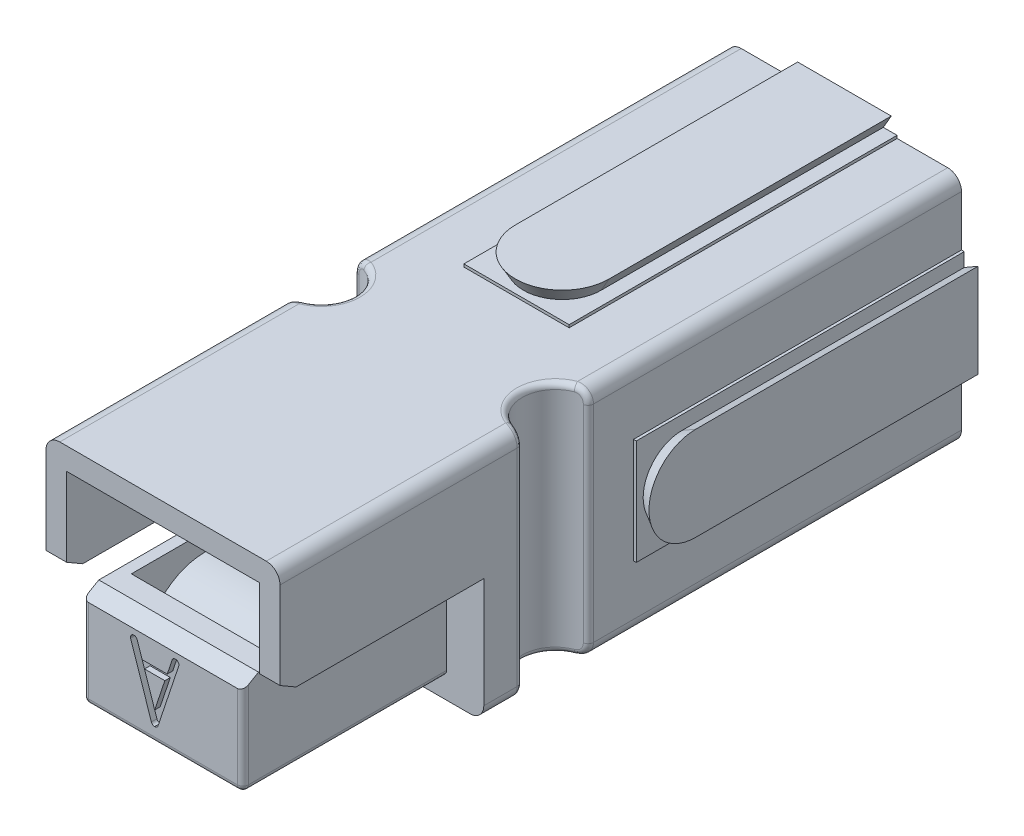
from build123d import *

# Parameters (mm, degrees)
EXTRUSION1_OUTLINE_W     = 8.5
EXTRUSION1_OUTLINE_H     = 8.5
EXTRUSION1_DEPTH         = 24.75
ENL_V_MAT_EXTRU_5_DEPTH  = 7.4
SKETCH2_W                = 7
SKETCH2_H                = 3.4
CUT_EXTRUDE12_DEPTH      = 8
ESQUISSE8_W              = 5.7
ESQUISSE8_H              = 5.7
ENL_V_MAT_EXTRU_7_DEPTH  = 10
CUT_EXTRUDE7_DEPTH       = 10.25
CUT_REVOLVE1_ANGLE       = 180
BOSS_EXTRUDE5_DEPTH      = 0.1
CUT_REVOLVE2_ANGLE       = 180
BOSS_EXTRUDE6_DEPTH      = 0.1
SKETCH16_W               = 3.82264973
SKETCH16_H               = 11.911324865
BOSS_EXTRUDE7_DEPTH      = 0.1
SKETCH17_W               = 11.911324865
SKETCH17_H               = 3.82264973
BOSS_EXTRUDE8_DEPTH      = 0.1
BOSS_EXTRUDE4_DEPTH      = 10.25
REVOLVE1_ANGLE           = 180
REVOLVE2_ANGLE           = 180
SKETCH13_W               = 5
SKETCH13_H               = 6.65
CUT_EXTRUDE16_DEPTH      = 2.5
EXTRUSION2_DEPTH         = 1.75
EXTRUSION2_DEPTH_BACK    = 1.75
SKETCH9_R                = 2
CUT_EXTRUDE9_DEPTH       = 6.75
CUT_EXTRUDE10_DEPTH      = 8.6
FILLET1_R                = 0.5
FILLET2_R                = 0.2
CUT_EXTRUDE11_DEPTH      = 4.5
CUT_EXTRUDE11_DEPTH_BACK = 4.5
CUT_EXTRUDE17_DEPTH      = 0.2
SCALE1_SCALE             = 0.956


# Read off the part's stored shape, not the designer's step: Extrusion1
with BuildPart() as part:
    # Extrusion1 outline → Extrusion1 (new body)
    with BuildSketch(Plane.XY):
        Rectangle(EXTRUSION1_OUTLINE_W, EXTRUSION1_OUTLINE_H)
    extrude(amount=EXTRUSION1_DEPTH)

    # Esquisse5 → Enlèv. mat.-Extru.5 (cut)
    with BuildSketch(Plane.XY.offset(24.75)):
        Polygon((-4.25, 0.25), (-4.25, -4.25), (4.25, -4.25), (4.25, 0.25), (2.9, 0.25), (2.9, -3.51), (0, -3.51), (-2.9, -3.51), (-2.9, 0.25), align=None)
    extrude(amount=-ENL_V_MAT_EXTRU_5_DEPTH, mode=Mode.SUBTRACT)

    # Sketch2 → Cut-Extrude12 (cut)
    with BuildSketch(Plane.XY.offset(17.35)):
        with Locations((0, 1.75)):
            Rectangle(SKETCH2_W, SKETCH2_H)
    extrude(amount=CUT_EXTRUDE12_DEPTH, mode=Mode.SUBTRACT)

    # Esquisse8 → Enlèv. mat.-Extru.7 (cut)
    with BuildSketch(Plane(origin=(0, 0, 0), x_dir=(-1, 0, 0), z_dir=(0, 0, -1))):
        Rectangle(ESQUISSE8_W, ESQUISSE8_H)
    extrude(amount=-ENL_V_MAT_EXTRU_7_DEPTH, mode=Mode.SUBTRACT)

    # Esquisse12 → Cut-Extrude7 (cut)
    with BuildSketch(Plane(origin=(0, 0, 0), x_dir=(-1, 0, 0), z_dir=(0, 0, -1))):
        Polygon((3.75, 1.7), (4.25, 1.411324865), (4.25, -1.411324865), (3.75, -1.7), align=None)
        Polygon((-1.411324865, -4.25), (1.411324865, -4.25), (1.7, -3.75), (-1.7, -3.75), align=None)
    extrude(amount=-CUT_EXTRUDE7_DEPTH, mode=Mode.SUBTRACT)

    # Sketch3 → Cut-Revolve1 (revolve, cut)
    with BuildSketch(Plane(origin=(0, 0, 10.25), x_dir=(-1, 0, 0), z_dir=(0, 0, -1))):
        Polygon((3.75, 0), (3.75, -1.7), (4.25, -1.411324865), (4.25, 0), align=None)
    revolve(axis=Axis((-3.75, 0, 10.25), (-1, 0, 0)), revolution_arc=CUT_REVOLVE1_ANGLE, mode=Mode.SUBTRACT)

    # Sketch14 → Boss-Extrude5 (add)
    with BuildSketch(Plane.ZY.offset(4.25)):
        with BuildLine():
            Line((0, 1.411324865), (10.25, 1.411324865))
            ThreePointArc((10.25, 1.411324865), (11.661324865, 0), (10.25, -1.411324865))
            Line((10.25, -1.411324865), (0, -1.411324865))
            Line((0, -1.411324865), (0, -1.911324865))
            Line((0, -1.911324865), (11.911324865, -1.911324865))
            Line((11.911324865, -1.911324865), (11.911324865, 1.911324865))
            Line((11.911324865, 1.911324865), (0, 1.911324865))
            Line((0, 1.911324865), (0, 1.411324865))
        make_face()
    extrude(amount=BOSS_EXTRUDE5_DEPTH)

    # Sketch4 → Cut-Revolve2 (revolve, cut)
    with BuildSketch(Plane(origin=(0, 0, 10.25), x_dir=(-1, 0, 0), z_dir=(0, 0, -1))):
        Polygon((0, -3.75), (1.7, -3.75), (1.411324865, -4.25), (0, -4.25), align=None)
    revolve(axis=Axis((0, -3.75, 10.25), (0, 1, 0)), revolution_arc=CUT_REVOLVE2_ANGLE, mode=Mode.SUBTRACT)

    # Sketch15 → Boss-Extrude6 (add)
    with BuildSketch(Plane.XZ.offset(4.25)):
        with BuildLine():
            Line((-1.411324865, 0), (-1.411324865, 10.25))
            ThreePointArc((-1.411324865, 10.25), (0, 11.661324865), (1.411324865, 10.25))
            Line((1.411324865, 10.25), (1.411324865, 0))
            Line((1.411324865, 0), (1.911324865, 0))
            Line((1.911324865, 0), (1.911324865, 11.911324865))
            Line((1.911324865, 11.911324865), (-1.911324865, 11.911324865))
            Line((-1.911324865, 11.911324865), (-1.911324865, 0))
            Line((-1.911324865, 0), (-1.411324865, 0))
        make_face()
    extrude(amount=BOSS_EXTRUDE6_DEPTH)

    # Sketch16 → Boss-Extrude7 (add)
    with BuildSketch(Plane(origin=(0, 4.25, 0), x_dir=(-1, 0, 0), z_dir=(0, 1, 0))):
        with Locations((0, 5.955662433)):
            Rectangle(SKETCH16_W, SKETCH16_H)
    extrude(amount=BOSS_EXTRUDE7_DEPTH)

    # Sketch17 → Boss-Extrude8 (add)
    with BuildSketch(Plane(origin=(4.25, 0, 0), x_dir=(0, 0, -1), z_dir=(1, 0, 0))):
        with Locations((-5.955662433, 0)):
            Rectangle(SKETCH17_W, SKETCH17_H)
    extrude(amount=BOSS_EXTRUDE8_DEPTH)

    # Sketch5 → Boss-Extrude4 (add)
    with BuildSketch(Plane(origin=(0, 0, 0), x_dir=(-1, 0, 0), z_dir=(0, 0, -1))):
        Polygon((1.411324865, 4.35), (-1.411324865, 4.35), (-1.7, 4.85), (1.7, 4.85), align=None)
        Polygon((-4.85, -1.7), (-4.85, 1.7), (-4.35, 1.411324865), (-4.35, -1.411324865), align=None)
    extrude(amount=-BOSS_EXTRUDE4_DEPTH)

    # Sketch6 → Revolve1 (revolve)
    with BuildSketch(Plane.XY.offset(10.25)):
        Polygon((0, 4.35), (1.411324865, 4.35), (1.7, 4.85), (0, 4.85), align=None)
    revolve(axis=Axis((0, 4.85, 10.25), (0, -1, 0)), revolution_arc=REVOLVE1_ANGLE)

    # Sketch7 → Revolve2 (revolve)
    with BuildSketch(Plane.XY.offset(10.25)):
        Polygon((4.85, -1.7), (4.85, 0), (4.35, 0), (4.35, -1.411324865), align=None)
    revolve(axis=Axis((4.85, 0, 10.25), (-1, 0, 0)), revolution_arc=REVOLVE2_ANGLE)

    # Sketch13 → Cut-Extrude16 (cut)
    with BuildSketch(Plane(origin=(0, 0.05, 0), x_dir=(-1, 0, 0), z_dir=(0, 1, 0))):
        with Locations((0, 20.075)):
            Rectangle(SKETCH13_W, SKETCH13_H)
    extrude(amount=-CUT_EXTRUDE16_DEPTH, mode=Mode.SUBTRACT)

    # Esquisse13 → Extrusion2 (add, two sides: drawn at the far end of the back side and taken through both)
    with BuildSketch(Plane(origin=(0, 0, 0), x_dir=(0, 0, -1), z_dir=(1, 0, 0)).offset(-EXTRUSION2_DEPTH_BACK)):
        with BuildLine():
            Line((-20.021850609, -0.403595516), (-16.75, -1.320909339))
            Line((-16.75, -1.320909339), (-16.75, -1.632477036))
            Line((-16.75, -1.632477036), (-20.171808548, -0.67312019))
            ThreePointArc((-20.171808548, -0.67312019), (-21.988556787, -0.221962307), (-23.305541831, -1.552250996))
            Line((-23.305541831, -1.552250996), (-23.595190502, -1.474125154))
            ThreePointArc((-23.595190502, -1.474125154), (-22.106613177, 0.05614832), (-20.021850609, -0.403595516))
        make_face()
    extrude(amount=EXTRUSION2_DEPTH + EXTRUSION2_DEPTH_BACK)

    # Sketch9 → Cut-Extrude9 (cut)
    with BuildSketch(Plane(origin=(0, 0, 10), x_dir=(-1, 0, 0), z_dir=(0, 0, -1))):
        Circle(SKETCH9_R)
    extrude(amount=-CUT_EXTRUDE9_DEPTH, mode=Mode.SUBTRACT)

    # Sketch10 → Cut-Extrude10 (cut)
    with BuildSketch(Plane(origin=(0, 4.25, 0), x_dir=(-1, 0, 0), z_dir=(0, 1, 0))):
        with BuildLine():
            Line((4.25, 13.55), (4.25, 15.95))
            ThreePointArc((4.25, 15.95), (3.05, 14.75), (4.25, 13.55))
        make_face()
        with BuildLine():
            Line((-4.25, 13.55), (-4.25, 15.95))
            ThreePointArc((-4.25, 15.95), (-3.05, 14.75), (-4.25, 13.55))
        make_face()
    extrude(amount=-CUT_EXTRUDE10_DEPTH, mode=Mode.SUBTRACT)

    # Fillet1
    fillet1_edges = [part.edges().sort_by_distance(p)[0] for p in [
        (-4.25, -4.25, 16.65),
        (-4.25, -4.25, 6.775),
        (4.25, -4.25, 16.65),
        (4.25, -4.25, 6.775),
        (-4.25, 4.25, 20.35),
        (-4.25, 4.25, 6.775),
        (4.25, 4.25, 20.35),
        (4.25, 4.25, 6.775),
    ]]
    fillet(fillet1_edges, radius=FILLET1_R)

    # Fillet2
    fillet2_edges = [part.edges().sort_by_distance(p)[0] for p in [
        (-2.9, -3.51, 21.05),
        (2.9, -3.51, 21.05),
        (-2.9, -1.73, 24.75),
        (0, -3.51, 24.75),
        (-3.05, -4.25, 14.75),
        (3.05, -4.25, 14.75),
        (-4.25, 0, 15.95),
        (-3.05, 4.25, 14.75),
        (-4.25, 0, 13.55),
        (-4.098419967, 4.108613337, 13.559612042),
        (-4.098419967, 4.108613337, 15.940387958),
        (-4.098419967, -4.108613337, 13.559612042),
        (-4.098419967, -4.108613337, 15.940387958),
        (4.25, 0, 15.95),
        (4.25, 0, 13.55),
        (3.05, 4.25, 14.75),
        (4.098419968, 4.108613336, 15.940387958),
        (4.098419968, 4.108613336, 13.559612042),
        (4.098419968, -4.108613336, 13.559612042),
        (4.098419968, -4.108613336, 15.940387958),
        (2.9, -1.73, 24.75),
    ]]
    fillet(fillet2_edges, radius=FILLET2_R)

    # Sketch11 → Cut-Extrude11 (cut, two sides: drawn at the far end of the back side and taken through both)
    with BuildSketch(Plane(origin=(0, 0, 0), x_dir=(0, 0, -1), z_dir=(1, 0, 0)).offset(-CUT_EXTRUDE11_DEPTH_BACK)):
        Polygon((-24.75, 0.587787058), (-24.75, 0.154774356), (-24.75, -0.278238346), (-24, 0.154774356), align=None)
    extrude(amount=CUT_EXTRUDE11_DEPTH + CUT_EXTRUDE11_DEPTH_BACK, mode=Mode.SUBTRACT)

    # Sketch18 → Cut-Extrude17 (cut)
    with BuildSketch(Plane.XY.offset(24.75)):
        with BuildLine():
            add(Edge.make_bspline(
                [(-0.938724046, -0.563528277), (-0.944191724, -0.551624048), (-0.954636495, -0.528883696), (-0.981106752, -0.50166242), (-1.015652341, -0.484972709), (-1.041290488, -0.481884271), (-1.054683895, -0.480270866)],
                knots=[0, 0, 0, 0, 1.030204786, 1.967974398, 2.938466691, 4, 4, 4, 4], degree=3))
            add(Edge.make_bspline(
                [(-1.054683895, -0.480270866), (-1.063349062, -0.481046677), (-1.080242864, -0.482559217), (-1.104762507, -0.48884847), (-1.126158906, -0.501075545), (-1.145241402, -0.516348404), (-1.160928732, -0.534941244), (-1.172331782, -0.556433158), (-1.179752737, -0.580064512), (-1.18071603, -0.596746257), (-1.181208286, -0.605270866)],
                knots=[0, 0, 0, 0, 1.056706776, 2.060178993, 3.045553801, 4.025758264, 5.019051294, 5.976528354, 6.965977191, 8, 8, 8, 8], degree=3))
            add(Edge.make_bspline(
                [(-1.181208286, -0.605270866), (-1.180772862, -0.611545292), (-1.179959166, -0.62327059), (-1.178383754, -0.634917439), (-1.177651375, -0.640331842)],
                knots=[0, 0, 0, 0, 1.070237272, 2, 2, 2, 2], degree=3))
            Line((-1.177651375, -0.640331842), (-0.422423193, -2.892666064))
            add(Edge.make_bspline(
                [(-0.422423193, -2.892666064), (-0.416980421, -2.905407343), (-0.406559594, -2.929802019), (-0.378619073, -2.958036272), (-0.34318481, -2.975784086), (-0.316920666, -2.978728259), (-0.303159505, -2.980270866)],
                knots=[0, 0, 0, 0, 1.046023809, 2.002735461, 2.953528535, 4, 4, 4, 4], degree=3))
            add(Edge.make_bspline(
                [(-0.303159505, -2.980270866), (-0.288705278, -2.978395566), (-0.26139994, -2.974852956), (-0.225084646, -2.956637759), (-0.196382931, -2.92915125), (-0.185703322, -2.905221586), (-0.180192025, -2.892872492)],
                knots=[0, 0, 0, 0, 1.085971307, 2.051497763, 2.994459901, 4, 4, 4, 4], degree=3))
            Line((-0.180192025, -2.892872492), (0.571543755, -0.639848026))
            add(Edge.make_bspline(
                [(0.571543755, -0.639848026), (0.573407526, -0.634638878), (0.577405925, -0.62346355), (0.578084118, -0.611602912), (0.578446186, -0.605270866)],
                knots=[0, 0, 0, 0, 0.932258736, 2, 2, 2, 2], degree=3))
            add(Edge.make_bspline(
                [(0.578446186, -0.605270866), (0.577739781, -0.596751113), (0.57635889, -0.58009657), (0.569094196, -0.556429724), (0.557649662, -0.534941594), (0.541972963, -0.51635063), (0.522890322, -0.501066439), (0.501626662, -0.488964504), (0.47733347, -0.482487569), (0.460592154, -0.481027196), (0.451921796, -0.480270866)],
                knots=[0, 0, 0, 0, 1.038553346, 2.030179789, 2.989764092, 3.985243189, 4.967604913, 5.955148361, 6.940967594, 8, 8, 8, 8], degree=3))
            add(Edge.make_bspline(
                [(0.451921796, -0.480270866), (0.438167351, -0.481843151), (0.411990839, -0.484835416), (0.376853215, -0.501957732), (0.348748985, -0.528411746), (0.338049625, -0.551600706), (0.332511227, -0.563604199)],
                knots=[0, 0, 0, 0, 1.068215676, 2.032954511, 2.981782019, 4, 4, 4, 4], degree=3))
            Line((0.332511227, -0.563604199), (0.153585922, -1.101205329))
            Line((0.153585922, -1.101205329), (-0.756087009, -1.101205329))
            Line((-0.756087009, -1.101205329), (-0.938724046, -0.563528277))
        make_face()
        Polygon((-0.671792992, -1.351205825), (0.065779654, -1.351205825), (-0.303006669, -2.458254542), align=None, mode=Mode.SUBTRACT)
    extrude(amount=-CUT_EXTRUDE17_DEPTH, mode=Mode.SUBTRACT)


with BuildPart() as part_1:
    # Scale1: scaled about (0.171696158, 0.261373201, 11.342083707)
    add(part.part.scale(SCALE1_SCALE).moved(Location((0.007554631, 0.011500421, 0.499051683))))


solid = part_1.part
